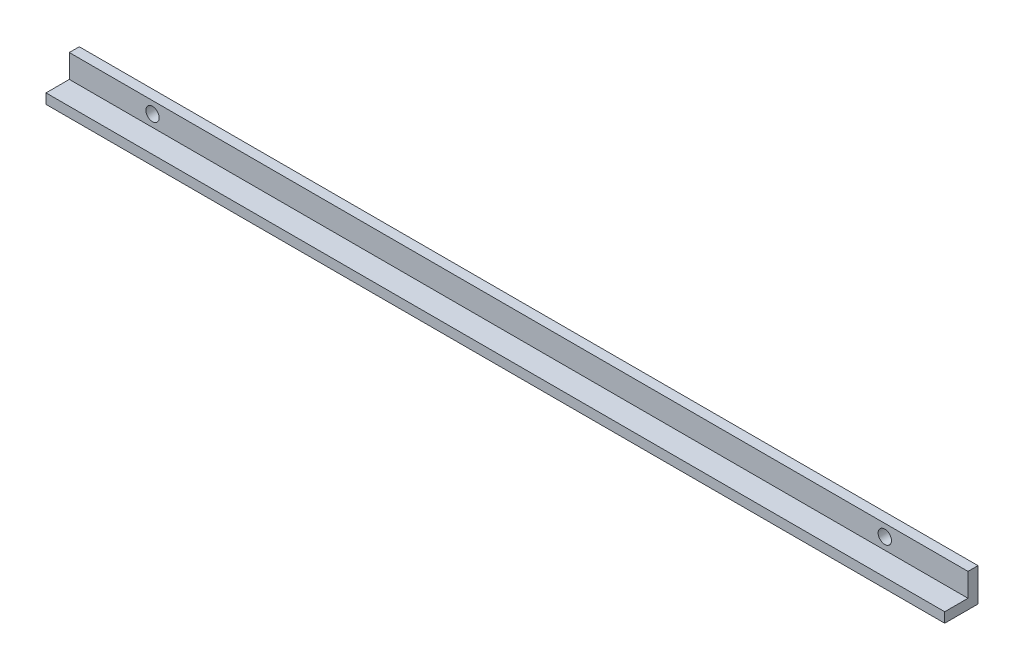
from build123d import *

# Parameters (mm, degrees)
EXTRUDE_1_DEPTH     = 270
SKETCH_2_R          = 2
CUT_EXTRUDE_1_DEPTH = 271.275785079


with BuildPart() as part:
    # Эскиз1 → Бобышка-Вытянуть1 (new body)
    with BuildSketch(Plane(origin=(0, 0, 0), x_dir=(0, 0, -1), z_dir=(1, 0, 0))):
        Polygon((0, 0), (-10, 0), (-10, 3), (-3, 3), (-3, 10), (0, 10), align=None)
    extrude(amount=EXTRUDE_1_DEPTH)

    # Эскиз2 → Вырез-Вытянуть1 (cut, through all)
    with BuildSketch(Plane.XY.offset(3)):
        with Locations((25, 6.5)):
            Circle(SKETCH_2_R)
        with Locations((245, 6.5)):
            Circle(SKETCH_2_R)
    extrude(amount=-CUT_EXTRUDE_1_DEPTH, mode=Mode.SUBTRACT)


solid = part.part
